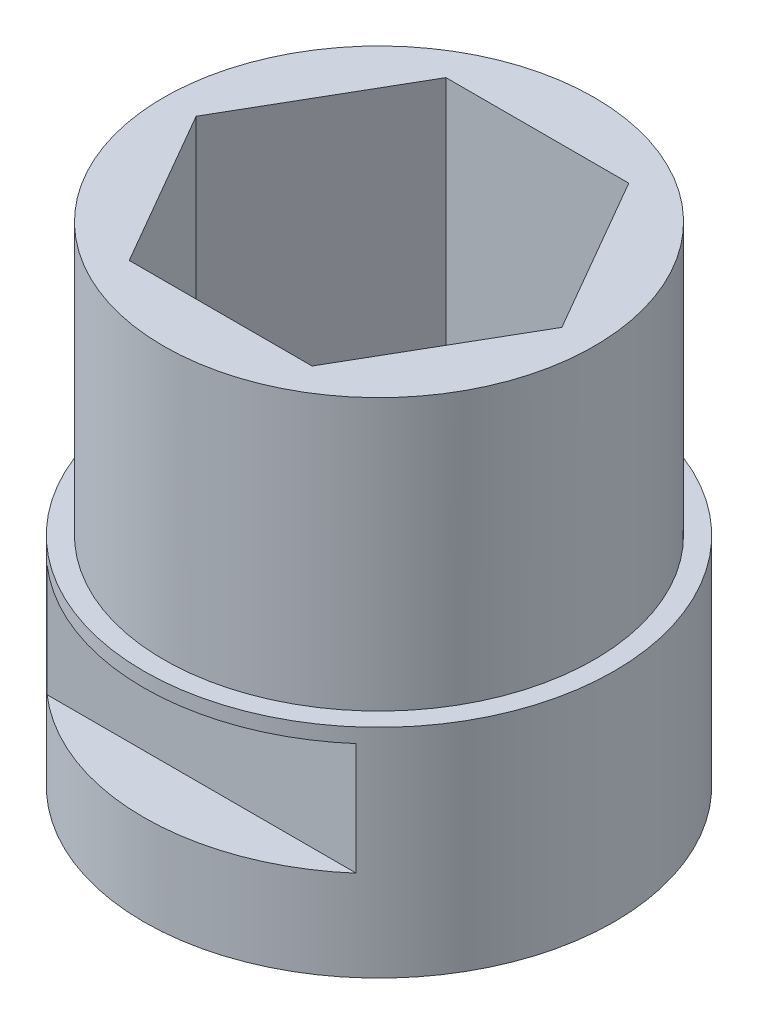
from build123d import *

# Parameters (mm, degrees)
SKETCH1_R               = 7.5565
BOSS_EXTRUDE1_DEPTH     = 16.51
BOSS_EXTRUDE2_START     = 0.635
SKETCH2_R               = 7.5565
SKETCH2_R_2             = 3.3
BOSS_EXTRUDE2_DEPTH     = 0.635
SKETCH4_R               = 8.255
SKETCH4_R_2             = 7.5565
BOSS_EXTRUDE3_DEPTH     = 7.62
CUT_EXTRUDE1_DEPTH      = 21.220537827
CUT_EXTRUDE1_DEPTH_BACK = 21.220537827
SKETCH3_W               = 2.572814656
SKETCH3_H               = 3.937
SKETCH3_W_2             = 2.256055482


with BuildPart() as part:
    # Sketch1 → Boss-Extrude1 (new body)
    with BuildSketch(Plane(origin=(0, 0, 0), x_dir=(1, 0, 0), z_dir=(0, 1, 0))):
        Circle(SKETCH1_R)
        Polygon((-3.207902433, 5.55625), (-6.415804866, 0), (-3.207902433, -5.55625), (3.207902433, -5.55625), (6.415804866, 0), (3.207902433, 5.55625), align=None, mode=Mode.SUBTRACT)
    extrude(amount=BOSS_EXTRUDE1_DEPTH)

    # Sketch2 → Boss-Extrude2 (add)
    with BuildSketch(Plane.XZ.offset(BOSS_EXTRUDE2_START)):
        Circle(SKETCH2_R)
        Circle(SKETCH2_R_2, mode=Mode.SUBTRACT)
    extrude(amount=-BOSS_EXTRUDE2_DEPTH)

    # Sketch4 → Boss-Extrude3 (add)
    with BuildSketch(Plane.XZ.offset(0.635)):
        Circle(SKETCH4_R)
        Circle(SKETCH4_R_2, mode=Mode.SUBTRACT)
    extrude(amount=-BOSS_EXTRUDE3_DEPTH)

    # Sketch3 → Cut-Extrude1 (cut, two sides: drawn at the far end of the back side and taken through both)
    with BuildSketch(Plane(origin=(0, 0, 0), x_dir=(0, 0, -1), z_dir=(1, 0, 0)).offset(-CUT_EXTRUDE1_DEPTH_BACK)):
        with Locations((-7.509407328, 4.5085)):
            Rectangle(SKETCH3_W, SKETCH3_H)
        with Locations((7.351027741, 4.5085)):
            Rectangle(SKETCH3_W_2, SKETCH3_H)
    extrude(amount=CUT_EXTRUDE1_DEPTH + CUT_EXTRUDE1_DEPTH_BACK, mode=Mode.SUBTRACT)


solid = part.part
